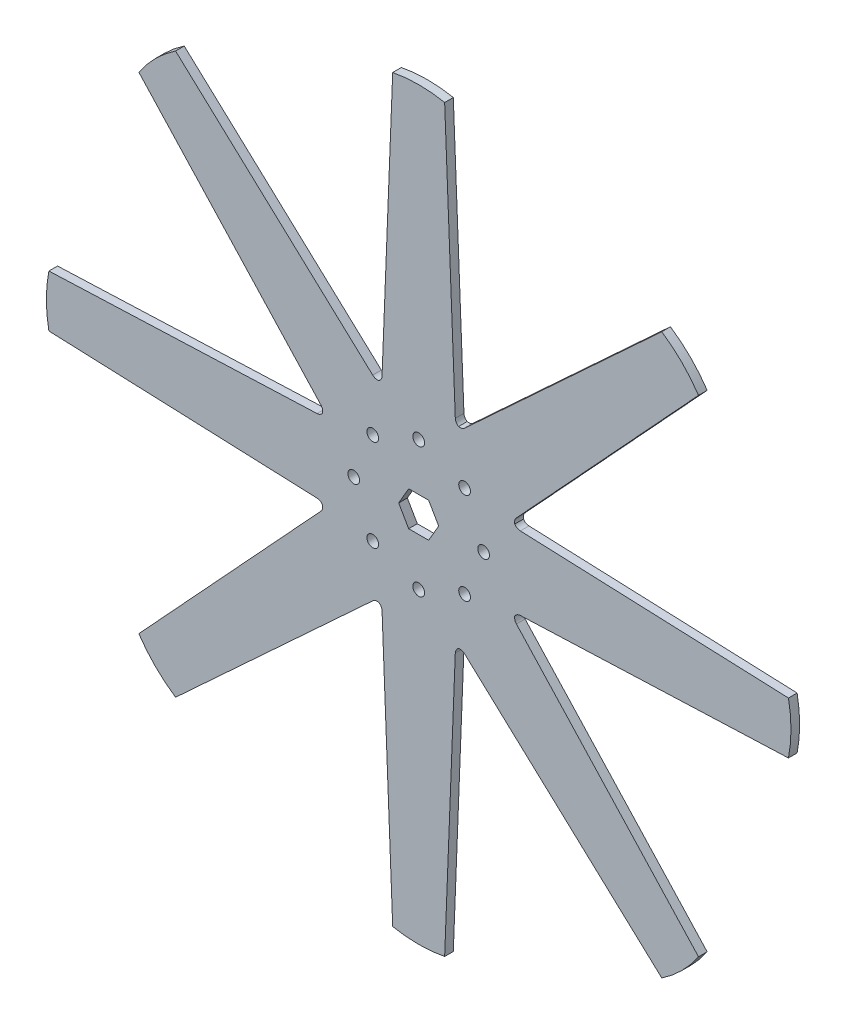
from build123d import *

# Parameters (mm, degrees)
SKETCH1_R           = 38.1
BOSS_EXTRUDE1_DEPTH = 3.175
BOSS_EXTRUDE2_START = -3.175
BOSS_EXTRUDE2_DEPTH = 3.175
CIRPATTERN1_COUNT   = 8
CUT_EXTRUDE1_DEPTH  = 3.175
SKETCH4_R           = 2.15011
CUT_EXTRUDE2_DEPTH  = 3.175
CIRPATTERN2_COUNT   = 8
FILLET1_R           = 2.54


with BuildPart() as part:
    # Sketch1 → Boss-Extrude1 (new body)
    with BuildSketch(Plane.XY):
        Circle(SKETCH1_R)
    extrude(amount=BOSS_EXTRUDE1_DEPTH)

    # Sketch2 → Boss-Extrude2 (add)
    with BuildSketch(Plane.XY.offset(3.175).offset(BOSS_EXTRUDE2_START)):
        with BuildLine():
            Line((-13.49375, 35.630446404), (-9.525, 135.594427584))
            ThreePointArc((-9.525, 135.594427584), (0, 136.525), (9.525, 135.594427584))
            Line((9.525, 135.594427584), (13.49375, 35.630446404))
            ThreePointArc((13.49375, 35.630446404), (0, 38.1), (-13.49375, 35.630446404))
        make_face()
    boss_extrude2 = extrude(amount=BOSS_EXTRUDE2_DEPTH)

    # CirPattern1: Boss-Extrude2 ×8 about axis
    cirpattern1_axis = Axis((0, 0, 0), (0, 0, 1))
    for i in range(1, CIRPATTERN1_COUNT):
        add(boss_extrude2.rotate(cirpattern1_axis, i * 360 / CIRPATTERN1_COUNT))

    # Sketch3 → Cut-Extrude1 (cut)
    with BuildSketch(Plane.XY.offset(3.175)):
        Polygon((3.666174209, 6.35), (-3.666174209, 6.35), (-7.332348419, 0), (-3.666174209, -6.35), (3.666174209, -6.35), (7.332348419, 0), align=None)
    extrude(amount=-CUT_EXTRUDE1_DEPTH, mode=Mode.SUBTRACT)

    # Sketch4 → Cut-Extrude2 (cut)
    with BuildSketch(Plane.XY.offset(3.175)):
        with Locations((0, 23.8125)):
            Circle(SKETCH4_R)
    cut_extrude2 = extrude(amount=-CUT_EXTRUDE2_DEPTH, mode=Mode.SUBTRACT)

    # CirPattern2: Cut-Extrude2 ×8 about axis
    cirpattern2_axis = Axis((0, 0, 0), (0, 0, 1))
    for i in range(1, CIRPATTERN2_COUNT):
        add(cut_extrude2.rotate(cirpattern2_axis, i * 360 / CIRPATTERN2_COUNT), mode=Mode.SUBTRACT)

    # Fillet1
    # the kernel refuses this fillet: 2.54 mm, written as the material it adds along each edge
    with BuildSketch(Plane(origin=(35.630446404, 13.49375, 0), x_dir=(-0.37360418212206464, 0.9275882249688723, 0), z_dir=(0, 0, 1)), Plane(origin=(15.65300814, 34.736052398, 0), x_dir=(-0.9200819746824512, 0.3917258733661093, 0), z_dir=(0, 0, 1)), Plane(origin=(-13.49375, 35.630446404, 0), x_dir=(-0.9275882249688627, -0.3736041821220885, 0), z_dir=(0, 0, 1)), Plane(origin=(13.49375, -35.630446404, 0), x_dir=(0.9275882249688687, 0.37360418212207347, 0), z_dir=(0, 0, 1)), Plane(origin=(34.736052398, -15.65300814, 0), x_dir=(0.391725873366113, 0.9200819746824498, 0), z_dir=(0, 0, 1))) as fillet1_piece_1:
        with BuildLine():
            CenterArc((1.643083032, -2.539446931), FILLET1_R, 91.195689061, 64.592690386)
            Line((-0.673490842, -1.497772563), (0, 0))
            ThreePointArc((0, 0), (0.795040177, -0.008296033), (1.590080353, 0))
        make_face()
    extrude(amount=3.175)
    with BuildSketch(Plane(origin=(34.736052398, 15.65300814, 0), x_dir=(0.6784988435367945, 0.7346014697230276, 0), z_dir=(0, 0, 1)), Plane(origin=(13.49375, 35.630446404, 0), x_dir=(-0.03967054741864971, 0.9992128140028553, 0), z_dir=(0, 0, 1)), Plane(origin=(15.65300814, -34.736052398, 0), x_dir=(0.7346014697230239, -0.6784988435367986, 0), z_dir=(0, 0, 1)), Plane(origin=(35.630446404, -13.49375, 0), x_dir=(0.9992128140028553, 0.03967054741864829, 0), z_dir=(0, 0, 1))) as fillet1_piece_2:
        with BuildLine():
            CenterArc((1.642227927, -2.54), FILLET1_R, 90, 64.592690386)
            ThreePointArc((-0.652104703, -1.450212049), (-0.318486063, -0.728508294), (0, 0))
            Line((0, 0), (1.642227927, 0))
        make_face()
    extrude(amount=3.175)
    with BuildSketch(Plane(origin=(-15.65300814, 34.736052398, 0), x_dir=(0.9200819746824652, 0.3917258733660764, 0), z_dir=(0, 0, 1)), Plane(origin=(-35.630446404, 13.49375, 0), x_dir=(0.3736041821221092, 0.9275882249688544, 0), z_dir=(0, 0, 1)), Plane(origin=(-34.736052398, -15.65300814, 0), x_dir=(-0.3917258733660698, 0.9200819746824681, 0), z_dir=(0, 0, 1)), Plane(origin=(-13.49375, -35.630446404, 0), x_dir=(-0.9275882249688562, 0.3736041821221046, 0), z_dir=(0, 0, 1))) as fillet1_piece_3:
        with BuildLine():
            CenterArc((1.643083032, 2.539446931), FILLET1_R, 204.211620554, 64.592690386)
            Line((-0.673490842, 1.497772563), (0, 0))
            ThreePointArc((0, 0), (0.795040177, 0.008296033), (1.590080353, 0))
        make_face()
    extrude(amount=3.175)
    with BuildSketch(Plane(origin=(-34.736052398, 15.65300814, 0), x_dir=(-0.6784988435368002, 0.7346014697230224, 0), z_dir=(0, 0, 1)), Plane(origin=(-35.630446404, -13.49375, 0), x_dir=(-0.9992128140028552, 0.03967054741865222, 0), z_dir=(0, 0, 1)), Plane(origin=(-15.65300814, -34.736052398, 0), x_dir=(-0.7346014697230226, -0.6784988435368001, 0), z_dir=(0, 0, 1))) as fillet1_piece_4:
        with BuildLine():
            CenterArc((1.642227927, 2.54), FILLET1_R, 205.407309614, 64.592690386)
            ThreePointArc((-0.652104703, 1.450212049), (-0.318486063, 0.728508294), (0, 0))
            Line((0, 0), (1.642227927, 0))
        make_face()
    extrude(amount=3.175)


solid = part.part
